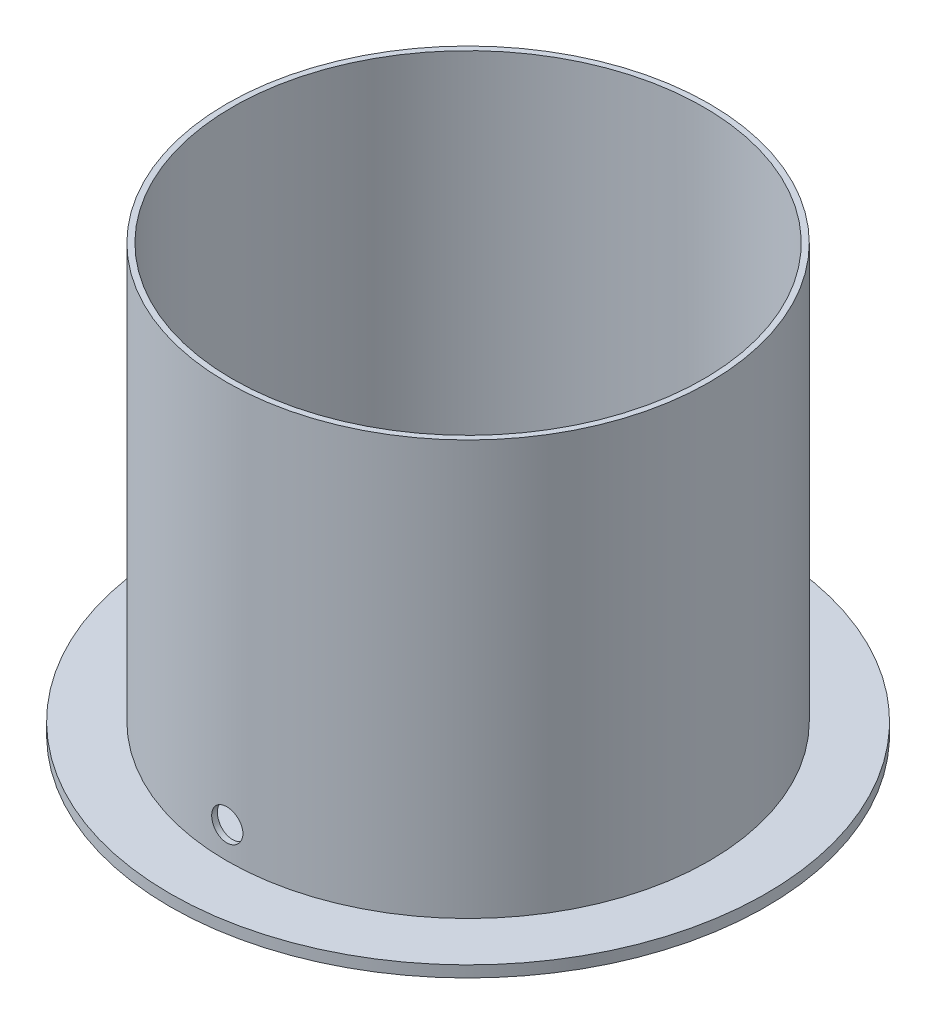
from build123d import *

# Parameters (mm, degrees)
BASE_FLANGE_SKETCH_R       = 210
BASE_FLANGE_DEPTH          = 8
TANK_WALL_SKETCH_R         = 170
TANK_WALL_SKETCH_R_2       = 166
TANK_WALL_DEPTH            = 300
TAP_DRAIN_PORTS_DEPTH      = 423.137418384
TAP_DRAIN_PORTS_DEPTH_BACK = 423.137418384
PORT_HOLES_SKETCH_R        = 11


with BuildPart() as part:
    # Base Flange Sketch → Base Flange (new body)
    with BuildSketch(Plane(origin=(0, 0, 0), x_dir=(1, 0, 0), z_dir=(0, 1, 0))):
        Circle(BASE_FLANGE_SKETCH_R)
    extrude(amount=BASE_FLANGE_DEPTH)

    # Tank Wall Sketch → Tank Wall (add)
    with BuildSketch(Plane(origin=(0, 0, 0), x_dir=(1, 0, 0), z_dir=(0, 1, 0))):
        Circle(TANK_WALL_SKETCH_R)
        Circle(TANK_WALL_SKETCH_R_2, mode=Mode.SUBTRACT)
    extrude(amount=TANK_WALL_DEPTH)

    # Port Holes Sketch → Tap + Drain Ports (cut, two sides: drawn at the far end of the back side and taken through both)
    with BuildSketch(Plane.XY.offset(-TAP_DRAIN_PORTS_DEPTH_BACK)):
        with Locations((0, 30)):
            Circle(PORT_HOLES_SKETCH_R)
    extrude(amount=TAP_DRAIN_PORTS_DEPTH + TAP_DRAIN_PORTS_DEPTH_BACK, mode=Mode.SUBTRACT)


solid = part.part
